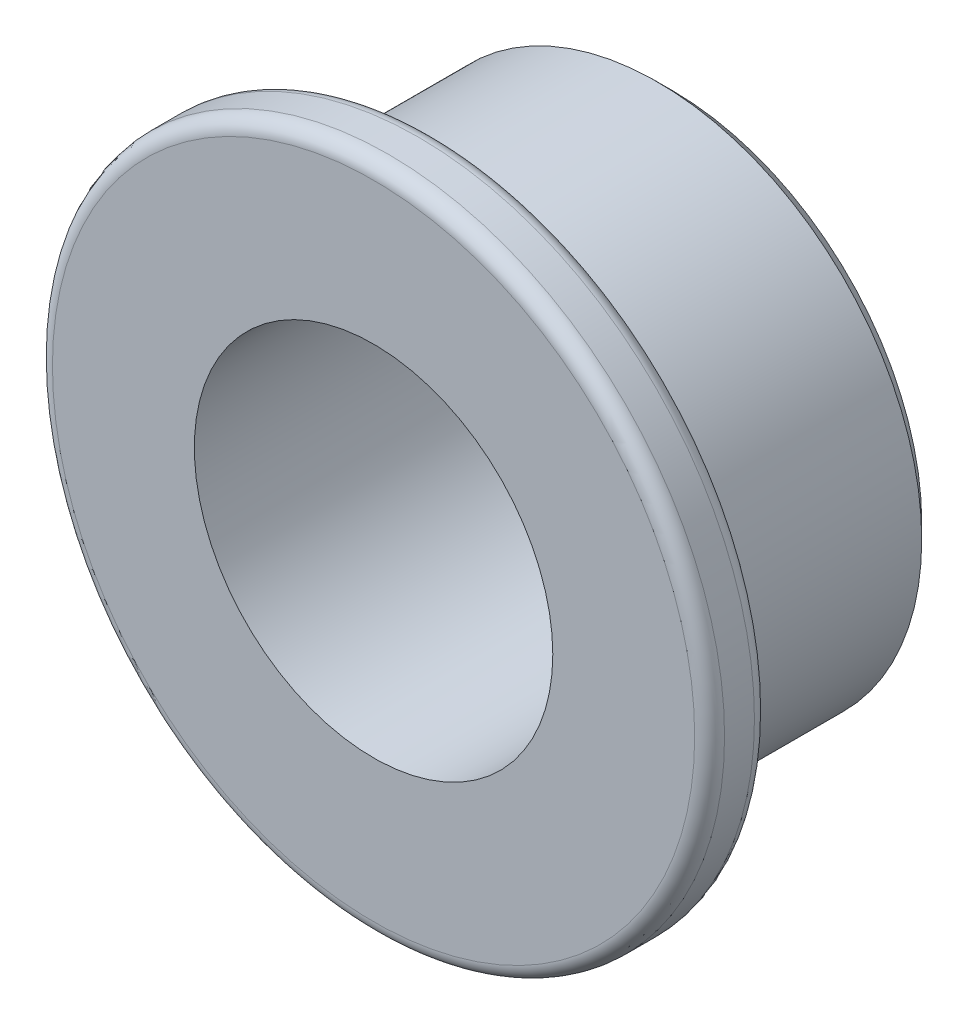
from build123d import *

# Parameters (mm, degrees)
SKETCH1_R           = 8.85
SKETCH1_R_2         = 6
BOSS_EXTRUDE1_DEPTH = 8
BOSS_EXTRUDE2_START = 2
SKETCH2_R           = 11.25
SKETCH2_R_2         = 6
BOSS_EXTRUDE2_DEPTH = 2
FILLET1_R           = 0.5
FILLET2_R           = 0.5
FILLET3_R           = 0.8
CHAMFER1_SIZE       = 0.5


with BuildPart() as part:
    # Sketch1 → Boss-Extrude1 (new body)
    with BuildSketch(Plane.XY):
        Circle(SKETCH1_R)
        Circle(SKETCH1_R_2, mode=Mode.SUBTRACT)
    extrude(amount=-BOSS_EXTRUDE1_DEPTH)

    # Sketch2 → Boss-Extrude2 (add)
    with BuildSketch(Plane.XY.offset(BOSS_EXTRUDE2_START)):
        Circle(SKETCH2_R)
        Circle(SKETCH2_R_2, mode=Mode.SUBTRACT)
    extrude(amount=-BOSS_EXTRUDE2_DEPTH)

    # Fillet1
    fillet1_edges = [part.edges().sort_by_distance(p)[0] for p in [
        (-11.25, 0, 2),
    ]]
    fillet(fillet1_edges, radius=FILLET1_R)

    # Fillet2
    fillet2_edges = [part.edges().sort_by_distance(p)[0] for p in [
        (-11.25, 0, 0),
    ]]
    fillet(fillet2_edges, radius=FILLET2_R)

    # Fillet3
    fillet3_edges = [part.edges().sort_by_distance(p)[0] for p in [
        (-8.85, 0, 0),
    ]]
    fillet(fillet3_edges, radius=FILLET3_R)

    # Chamfer1
    chamfer1_edges = [part.edges().sort_by_distance(p)[0] for p in [
        (-8.85, 0, -8),
    ]]
    chamfer(chamfer1_edges, length=CHAMFER1_SIZE)


solid = part.part
